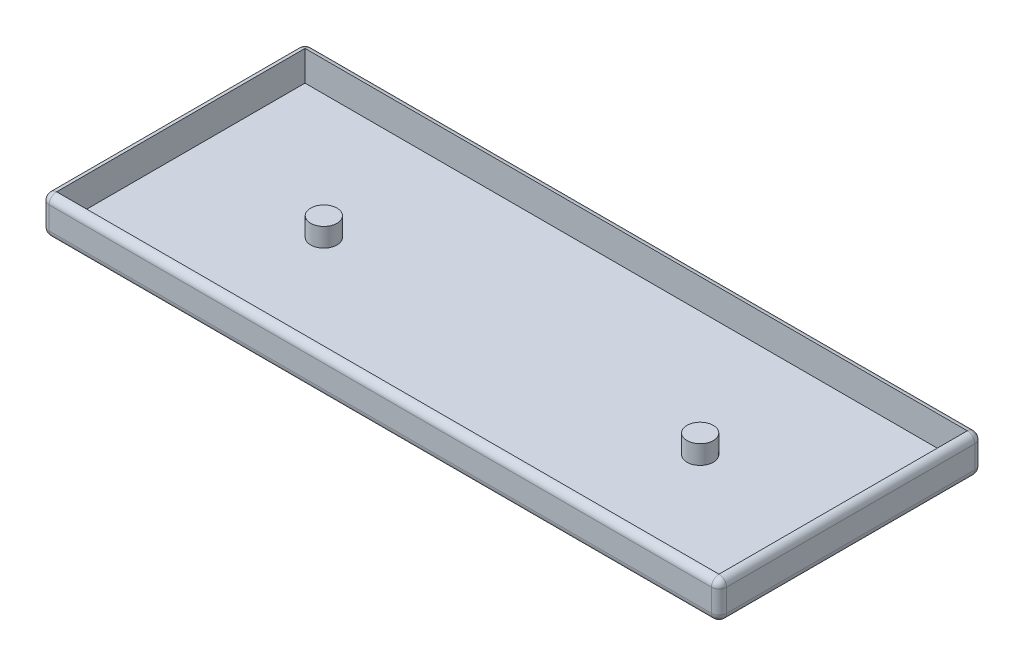
from build123d import *

# Parameters (mm, degrees)
SKETCH1_W           = 180
SKETCH1_H           = 70
BOSS_EXTRUDE1_DEPTH = 10
SKETCH2_R           = 1.5
CUT_EXTRUDE1_DEPTH  = 5
FILLET1_R           = 2
SHELL1_START        = 2
SHELL1_OUTLINE_W    = 176
SHELL1_OUTLINE_H    = 66
SHELL1_OUTLINE_R    = 3.5
SHELL1_DEPTH        = 8
SHELL1_START_2      = 7
SHELL1_2_OUTLINE_R  = 3.5
SHELL1_2_DEPTH      = 3


# Read off the part's stored shape, not the designer's step: Shell1
with BuildPart() as part:
    # Sketch1 → Boss-Extrude1 (new body)
    with BuildSketch(Plane(origin=(0, 0, 0), x_dir=(1, 0, 0), z_dir=(0, 1, 0))):
        Rectangle(SKETCH1_W, SKETCH1_H)
    extrude(amount=BOSS_EXTRUDE1_DEPTH)

    # Sketch2 → Cut-Extrude1 (cut)
    with BuildSketch(Plane.XZ):
        with Locations(Location((50, 0, 0), (0, 0, 270))):
            Circle(SKETCH2_R)
    cut_extrude1 = extrude(amount=-CUT_EXTRUDE1_DEPTH, mode=Mode.SUBTRACT)

    # Mirror1: Cut-Extrude1 across plane
    add(cut_extrude1.mirror(Plane(origin=(0, 0, 0), x_dir=(0, 0, 1), z_dir=(1, 0, 0))), mode=Mode.SUBTRACT)

    # Fillet1
    fillet1_edges = [part.edges().sort_by_distance(p)[0] for p in [
        (-90, 10, 0),
        (0, 10, 35),
        (90, 10, 0),
        (0, 0, 35),
        (-90, 0, 0),
        (0, 0, -35),
        (90, 0, 0),
        (90, 5, 35),
        (-90, 5, 35),
        (-90, 5, -35),
        (90, 5, -35),
        (0, 10, -35),
    ]]
    fillet(fillet1_edges, radius=FILLET1_R)

    # Shell1 outline → Shell1 (cut)
    with BuildSketch(Plane(origin=(0, 0, 0), x_dir=(1, 0, 0), z_dir=(0, 1, 0)).offset(SHELL1_START)):
        Rectangle(SHELL1_OUTLINE_W, SHELL1_OUTLINE_H)
        with Locations((-50, 0)):
            Circle(SHELL1_OUTLINE_R, mode=Mode.SUBTRACT)
        with Locations((50, 0)):
            Circle(SHELL1_OUTLINE_R, mode=Mode.SUBTRACT)
    extrude(amount=SHELL1_DEPTH, mode=Mode.SUBTRACT)

    # Shell1 2 outline → Shell1 2 (cut)
    with BuildSketch(Plane(origin=(0, 0, 0), x_dir=(1, 0, 0), z_dir=(0, 1, 0)).offset(SHELL1_START_2)):
        with Locations((50, 0)):
            Circle(SHELL1_2_OUTLINE_R)
        with Locations((-50, 0)):
            Circle(SHELL1_2_OUTLINE_R)
    extrude(amount=SHELL1_2_DEPTH, mode=Mode.SUBTRACT)


solid = part.part
